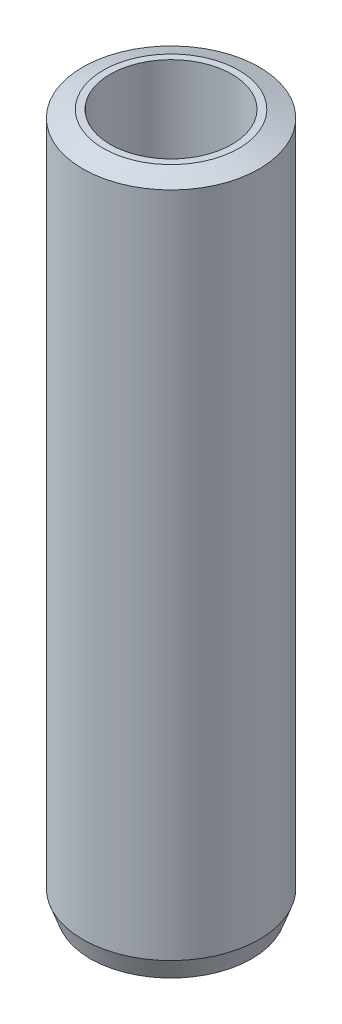
from build123d import *
from OCP.BRepFilletAPI import BRepFilletAPI_MakeChamfer

# Parameters (mm, degrees)
SKETCH1_R           = 27.5
BOSS_EXTRUDE1_DEPTH = 216.736957164
SKETCH2_R           = 18.965512597
CUT_EXTRUDE1_DEPTH  = 221.1985663
CHAMFER1_SIZE       = 2.335987041
CHAMFER1_SIZE2      = 6.379711926


with BuildPart() as part:
    # Sketch1 → Boss-Extrude1 (new body)
    with BuildSketch(Plane(origin=(0, 0, 0), x_dir=(1, 0, 0), z_dir=(0, 1, 0))):
        Circle(SKETCH1_R)
    extrude(amount=BOSS_EXTRUDE1_DEPTH)

    # Sketch2 → Cut-Extrude1 (cut, through all)
    with BuildSketch(Plane(origin=(0, 0, 0), x_dir=(1, 0, 0), z_dir=(0, 1, 0))):
        Circle(SKETCH2_R)
    extrude(amount=CUT_EXTRUDE1_DEPTH, mode=Mode.SUBTRACT)

    # Chamfer1: one chamfer whose edges measure the first distance from different faces: ONE call of the kernel's chamfer builder (chamfer() names one face for all edges)
    chamfer1_edges_1 = [part.edges().sort_by_distance(p)[0] for p in [
        (-27.5, 216.736957164, 0),
    ]]
    chamfer1_side_1 = [part.faces().sort_by_distance(p)[0] for p in [
        (-27.5, 108.368478582, 0),
    ]]
    chamfer1_edges_2 = [part.edges().sort_by_distance(p)[0] for p in [
        (-27.5, 0, 0),
    ]]
    chamfer1_side_2 = [part.faces().sort_by_distance(p)[0] for p in [
        (-26.722182541, 0, 0),
    ]]
    chamfer1 = BRepFilletAPI_MakeChamfer(part.part.solid().wrapped)
    for e in chamfer1_edges_1:
        chamfer1.Add(CHAMFER1_SIZE, CHAMFER1_SIZE2, e.wrapped, chamfer1_side_1[0].wrapped)  # the first distance lies on this face
    for e in chamfer1_edges_2:
        chamfer1.Add(CHAMFER1_SIZE, CHAMFER1_SIZE2, e.wrapped, chamfer1_side_2[0].wrapped)  # the first distance lies on this face
    add(Compound.cast(chamfer1.Shape()), mode=Mode.REPLACE)


solid = part.part
